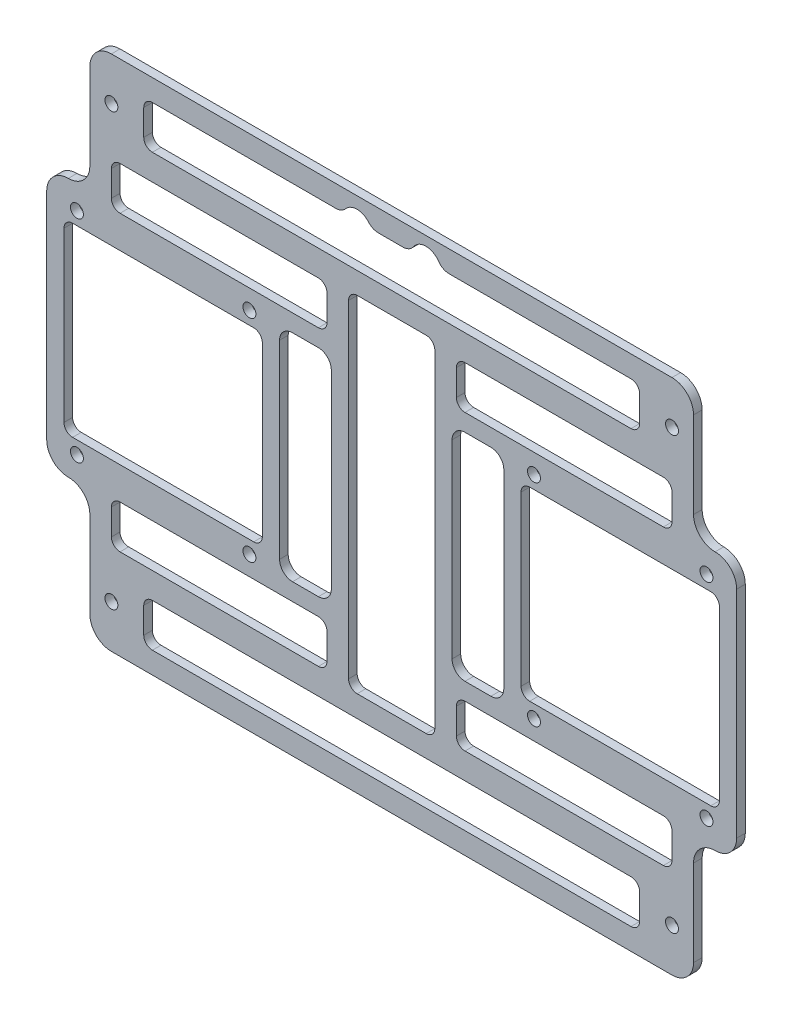
from build123d import *

# Parameters (mm, degrees)
SKETCH_1_R          = 1.5
EXTRUDE_1_DEPTH     = 2
SKETCH_2_R          = 1.5
SKETCH_2_W          = 46
SKETCH_2_H          = 43
CUT_EXTRUDE_1_DEPTH = 2
FILLET_1_R          = 2
SKETCH_3_W          = 115
SKETCH_3_H          = 10
CUT_EXTRUDE_2_DEPTH = 2
FILLET_2_R          = 2
SKETCH_4_W          = 20
SKETCH_4_H          = 80
SKETCH_4_W_2        = 50
SKETCH_4_H_2        = 10
CUT_EXTRUDE_3_DEPTH = 2
FILLET_3_R          = 2
FILLET_4_R          = 5
SKETCH_5_R          = 3.5
CUT_EXTRUDE_4_DEPTH = 2
SKETCH_6_W          = 12
SKETCH_6_H          = 50
CUT_EXTRUDE_5_DEPTH = 2
FILLET_5_R          = 3


with BuildPart() as part:
    # 草图1 → 凸台-拉伸1 (new body)
    with BuildSketch(Plane.XY):
        Polygon((-70, -60), (70, -60), (70, -30), (80, -30), (80, 30), (70, 30), (70, 60), (-70, 60), (-70, 30), (-80, 30), (-80, -30), (-70, -30), align=None)
        with Locations((-65, 50)):
            Circle(SKETCH_1_R, mode=Mode.SUBTRACT)
        with Locations((65, 50)):
            Circle(SKETCH_1_R, mode=Mode.SUBTRACT)
        with Locations((65, -50)):
            Circle(SKETCH_1_R, mode=Mode.SUBTRACT)
        with Locations((-65, -50)):
            Circle(SKETCH_1_R, mode=Mode.SUBTRACT)
    extrude(amount=EXTRUDE_1_DEPTH)

    # 草图2 → 切除-拉伸1 (cut)
    with BuildSketch(Plane.XY.offset(2)):
        with Locations((-73, 24.5)):
            Circle(SKETCH_2_R)
        with Locations((-33, 24.5)):
            Circle(SKETCH_2_R)
        with Locations((-73, -24.5)):
            Circle(SKETCH_2_R)
        with Locations((-33, -24.5)):
            Circle(SKETCH_2_R)
        with Locations((33, 24.5)):
            Circle(SKETCH_2_R)
        with Locations((73, 24.5)):
            Circle(SKETCH_2_R)
        with Locations((33, -24.5)):
            Circle(SKETCH_2_R)
        with Locations((73, -24.5)):
            Circle(SKETCH_2_R)
        with Locations((53, 0)):
            Rectangle(SKETCH_2_W, SKETCH_2_H)
        with Locations((-53, 0)):
            Rectangle(SKETCH_2_W, SKETCH_2_H)
    extrude(amount=-CUT_EXTRUDE_1_DEPTH, mode=Mode.SUBTRACT)

    # 圆角1
    fillet_1_edges = [part.edges().sort_by_distance(p)[0] for p in [
        (76, 21.5, 1),
        (76, -21.5, 1),
        (30, -21.5, 1),
        (30, 21.5, 1),
        (-30, 21.5, 1),
        (-30, -21.5, 1),
        (-76, -21.5, 1),
        (-76, 21.5, 1),
    ]]
    fillet(fillet_1_edges, radius=FILLET_1_R)

    # 草图3 → 切除-拉伸2 (cut)
    with BuildSketch(Plane.XY.offset(2)):
        with Locations((0, -50)):
            Rectangle(SKETCH_3_W, SKETCH_3_H)
        with Locations((0, 50)):
            Rectangle(SKETCH_3_W, SKETCH_3_H)
    extrude(amount=-CUT_EXTRUDE_2_DEPTH, mode=Mode.SUBTRACT)

    # 圆角2
    fillet_2_edges = [part.edges().sort_by_distance(p)[0] for p in [
        (57.5, -45, 1),
        (57.5, -55, 1),
        (-57.5, -55, 1),
        (-57.5, -45, 1),
        (-57.5, 45, 1),
        (-57.5, 55, 1),
        (57.5, 55, 1),
        (57.5, 45, 1),
    ]]
    fillet(fillet_2_edges, radius=FILLET_2_R)

    # 草图4 → 切除-拉伸3 (cut)
    with BuildSketch(Plane.XY.offset(2)):
        Rectangle(SKETCH_4_W, SKETCH_4_H)
        with Locations((40, 34)):
            Rectangle(SKETCH_4_W_2, SKETCH_4_H_2)
        with Locations((-40, 34)):
            Rectangle(SKETCH_4_W_2, SKETCH_4_H_2)
        with Locations((40, -34)):
            Rectangle(SKETCH_4_W_2, SKETCH_4_H_2)
        with Locations((-40, -34)):
            Rectangle(SKETCH_4_W_2, SKETCH_4_H_2)
    extrude(amount=-CUT_EXTRUDE_3_DEPTH, mode=Mode.SUBTRACT)

    # 圆角3
    fillet_3_edges = [part.edges().sort_by_distance(p)[0] for p in [
        (-15, -29, 1),
        (-15, -39, 1),
        (-65, -39, 1),
        (-65, -29, 1),
        (15, -29, 1),
        (65, -29, 1),
        (65, -39, 1),
        (15, -39, 1),
        (-15, 39, 1),
        (-15, 29, 1),
        (-65, 29, 1),
        (-65, 39, 1),
        (65, 39, 1),
        (65, 29, 1),
        (15, 29, 1),
        (15, 39, 1),
        (10, 40, 1),
        (10, -40, 1),
        (-10, -40, 1),
        (-10, 40, 1),
    ]]
    fillet(fillet_3_edges, radius=FILLET_3_R)

    # 圆角4
    fillet_4_edges = [part.edges().sort_by_distance(p)[0] for p in [
        (70, -60, 1),
        (-70, -60, 1),
        (70, 30, 1),
        (80, 30, 1),
        (80, -30, 1),
        (70, -30, 1),
        (-70, -30, 1),
        (-80, -30, 1),
        (-80, 30, 1),
        (-70, 30, 1),
        (70, 60, 1),
        (-70, 60, 1),
    ]]
    fillet(fillet_4_edges, radius=FILLET_4_R - 0.0001)  # a hair under: the kernel refuses the full size

    # 草图5 → 切除-拉伸4 (cut)
    with BuildSketch(Plane.XY.offset(2)):
        with Locations((-8.036845279, 53.77878744)):
            Circle(SKETCH_5_R)
        with Locations((7.953054881, 54.34720003)):
            Circle(SKETCH_5_R)
    extrude(amount=-CUT_EXTRUDE_4_DEPTH, mode=Mode.SUBTRACT)

    # 草图6 → 切除-拉伸5 (cut)
    with BuildSketch(Plane.XY.offset(2)):
        with Locations((20, 0)):
            Rectangle(SKETCH_6_W, SKETCH_6_H)
        with Locations((-20, 0)):
            Rectangle(SKETCH_6_W, SKETCH_6_H)
    extrude(amount=-CUT_EXTRUDE_5_DEPTH, mode=Mode.SUBTRACT)

    # 圆角5
    fillet_5_edges = [part.edges().sort_by_distance(p)[0] for p in [
        (11.391637758, 55, 1),
        (4.514472005, 55, 1),
        (-4.756808711, 55, 1),
        (-11.316881846, 55, 1),
        (26, 25, 1),
        (26, -25, 1),
        (14, -25, 1),
        (14, 25, 1),
        (-14, 25, 1),
        (-14, -25, 1),
        (-26, -25, 1),
        (-26, 25, 1),
    ]]
    fillet(fillet_5_edges, radius=FILLET_5_R)


solid = part.part
